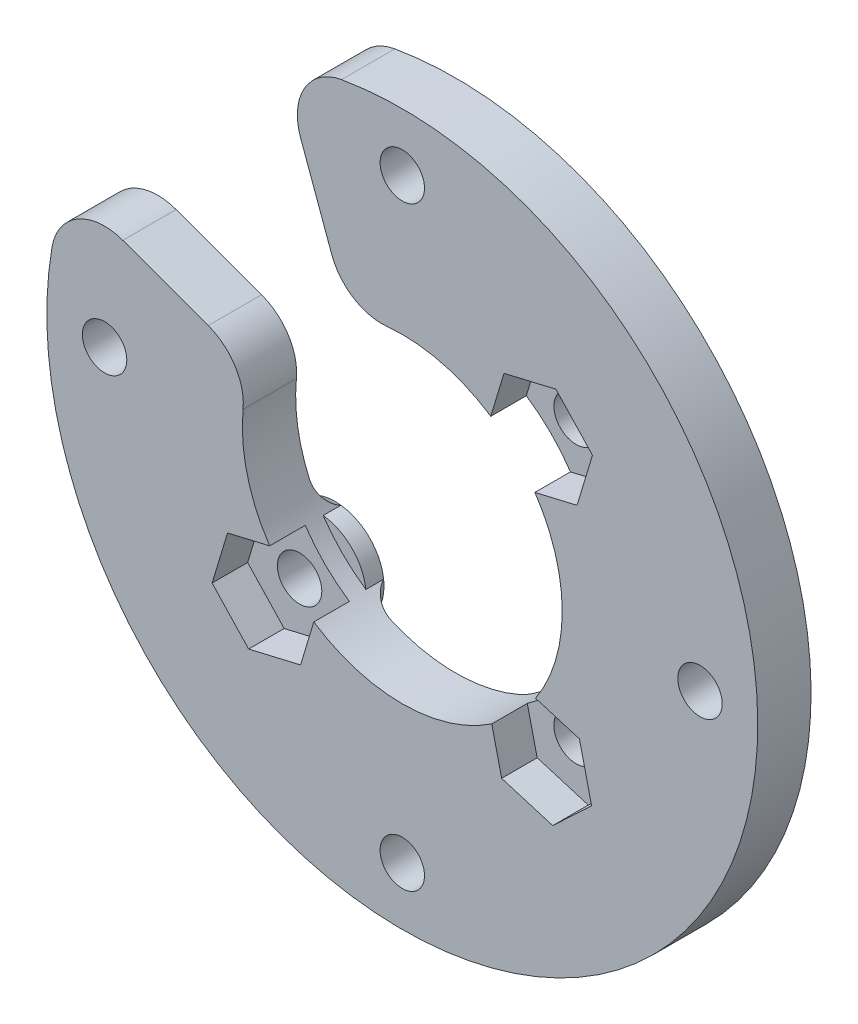
from build123d import *
from build123d.topology import SkipClean

# Parameters (mm, degrees)
SKETCH_1_R               = 20
SKETCH_1_R_2             = 1.25
SKETCH_1_R_3             = 9
EXTRUDE_5_DEPTH          = 3
SKETCH_1_6_R             = 9
SKETCH_1_6_R_2           = 2.3
SKETCH_1_6_R_3           = 1.25
CUT_EXTRUDE_1_DEPTH      = 1.1
SKETCH_2_R               = 1.25
CUT_EXTRUDE_2_DEPTH      = 31
EXTRUDE_START            = 1
SKETCH_3_R               = 2.75
SKETCH_3_R_2             = 1.25
EXTRUDE_6_DEPTH          = 1
FILLET_1_R               = 1.5
CUT_EXTRUDE_3_DEPTH      = 2
CUT_EXTRUDE_4_DEPTH      = 29.442925317
CUT_EXTRUDE_4_DEPTH_BACK = 29.442925317
FILLET_2_R               = 3


with BuildPart() as part:
    # 草图1 → 凸台-拉伸5 (new body)
    with BuildSketch(Plane.XY):
        Circle(SKETCH_1_R)
        with Locations((0, 16.75)):
            Circle(SKETCH_1_R_2, mode=Mode.SUBTRACT)
        with Locations((16.75, 0)):
            Circle(SKETCH_1_R_2, mode=Mode.SUBTRACT)
        with Locations((0, -16.75)):
            Circle(SKETCH_1_R_2, mode=Mode.SUBTRACT)
        with Locations((-16.75, 0)):
            Circle(SKETCH_1_R_2, mode=Mode.SUBTRACT)
        Circle(SKETCH_1_R_3, mode=Mode.SUBTRACT)
    extrude(amount=EXTRUDE_5_DEPTH)

    # 草图1<6> → 切除-拉伸1 (cut)
    # profile 1 of 8: a face of its own
    with BuildSketch(Plane.XY):
        Circle(SKETCH_1_6_R)
    # profile 2 of 8: a face of its own
    with BuildSketch(Plane.XY):
        with Locations((16.75, 0)):
            Circle(SKETCH_1_6_R_2)
        with Locations((16.75, 0)):
            Circle(SKETCH_1_6_R_3, mode=Mode.SUBTRACT)
    # profile 3 of 8: a face of its own
    with BuildSketch(Plane.XY):
        Circle(SKETCH_1_6_R)
    # profile 4 of 8: a face of its own
    with BuildSketch(Plane.XY):
        with Locations((0, 16.75)):
            Circle(SKETCH_1_6_R_2)
        with Locations((0, 16.75)):
            Circle(SKETCH_1_6_R_3, mode=Mode.SUBTRACT)
    # profile 5 of 8: a face of its own
    with BuildSketch(Plane.XY):
        Circle(SKETCH_1_6_R)
    # profile 6 of 8: a face of its own
    with BuildSketch(Plane.XY):
        with Locations((-16.75, 0)):
            Circle(SKETCH_1_6_R_2)
        with Locations((-16.75, 0)):
            Circle(SKETCH_1_6_R_3, mode=Mode.SUBTRACT)
    # profile 7 of 8: a face of its own
    with BuildSketch(Plane.XY):
        Circle(SKETCH_1_6_R)
    # profile 8 of 8: a face of its own
    with BuildSketch(Plane.XY):
        with Locations((0, -16.75)):
            Circle(SKETCH_1_6_R_2)
        with Locations((0, -16.75)):
            Circle(SKETCH_1_6_R_3, mode=Mode.SUBTRACT)
    extrude(amount=CUT_EXTRUDE_1_DEPTH, mode=Mode.SUBTRACT)

    # 草图2 → 切除-拉伸2 (cut)
    with BuildSketch(Plane.XY):
        with Locations((-7.778174593, 7.778174593)):
            Circle(SKETCH_2_R)
        with Locations((7.778174593, 7.778174593)):
            Circle(SKETCH_2_R)
        with Locations((7.778174593, -7.778174593)):
            Circle(SKETCH_2_R)
        with Locations((-7.778174593, -7.778174593)):
            Circle(SKETCH_2_R)
    extrude(amount=CUT_EXTRUDE_2_DEPTH, mode=Mode.SUBTRACT)

    # 草图3 → 凸台-拉伸6 (add)
    # profile 1 of 4: a face of its own
    with SkipClean():  # the faces are left unmerged after this step: merging them gives an invalid solid
        with BuildSketch(Plane(origin=(0, 0, 0), x_dir=(-1, 0, 0), z_dir=(0, 0, -1)).offset(EXTRUDE_START)):
            with Locations(Location((7.778174593, 7.778174593, 0), (0, 0, 186.827815893))):
                Circle(SKETCH_3_R)
            with Locations((7.778174593, 7.778174593)):
                Circle(SKETCH_3_R_2, mode=Mode.SUBTRACT)
        # profile 2 of 4: a face of its own
        with BuildSketch(Plane(origin=(0, 0, 0), x_dir=(-1, 0, 0), z_dir=(0, 0, -1)).offset(EXTRUDE_START)):
            with Locations(Location((7.778174593, -7.778174593, 0), (0, 0, 173.172184107))):
                Circle(SKETCH_3_R)
            with Locations((7.778174593, -7.778174593)):
                Circle(SKETCH_3_R_2, mode=Mode.SUBTRACT)
        # profile 3 of 4: a face of its own
        with BuildSketch(Plane(origin=(0, 0, 0), x_dir=(-1, 0, 0), z_dir=(0, 0, -1)).offset(EXTRUDE_START)):
            with Locations(Location((-7.778174593, -7.778174593, 0), (0, 0, 83.172184107))):
                Circle(SKETCH_3_R)
            with Locations((-7.778174593, -7.778174593)):
                Circle(SKETCH_3_R_2, mode=Mode.SUBTRACT)
        # profile 4 of 4: a face of its own
        with BuildSketch(Plane(origin=(0, 0, 0), x_dir=(-1, 0, 0), z_dir=(0, 0, -1)).offset(EXTRUDE_START)):
            with Locations(Location((-7.778174593, 7.778174593, 0), (0, 0, 276.827815893))):
                Circle(SKETCH_3_R)
            with Locations((-7.778174593, 7.778174593)):
                Circle(SKETCH_3_R_2, mode=Mode.SUBTRACT)
        extrude(amount=-EXTRUDE_6_DEPTH)

    # 圆角1
    # the kernel refuses this fillet: 1.5 mm, written as the material it adds along each edge
    with BuildSketch(Plane(origin=(-7.778174593, 7.778174593, 0), x_dir=(0.7048818539428432, -0.709324729571795, 0), z_dir=(0.709324729571795, 0.7048818539428432, 0))) as fillet_1_piece_1_section:
        with BuildLine():
            CenterArc((4.164213562, 1.5), FILLET_1_R, 199.471220634, 70.528779366)
            Line((2.75, 1), (2.75, 0))
            Line((2.75, 0), (4.164213562, 0))
        make_face()
    fillet_1_piece_1 = revolve(axis=Axis((-7.778174593, 7.778174593, 0), (0, 0, -1)), revolution_arc=359.64, mode=Mode.PRIVATE)
    fillet_1_piece_1 = fillet_1_piece_1 - Plane(origin=(0, 0, -0.272805639), x_dir=(1, 0, 0), z_dir=(0, 0, -1)) * Cylinder(9, 17, mode=Mode.PRIVATE)
    add(fillet_1_piece_1)
    with BuildSketch(Plane(origin=(-7.778174593, -7.778174593, 0), x_dir=(0.7093247295728082, 0.7048818539418237, 0), z_dir=(-0.7048818539418237, 0.7093247295728082, 0))) as fillet_1_piece_2_section:
        with BuildLine():
            CenterArc((4.164213562, 1.5), FILLET_1_R, 199.471220634, 70.528779366)
            Line((2.75, 1), (2.75, 0))
            Line((2.75, 0), (4.164213562, 0))
        make_face()
    fillet_1_piece_2 = revolve(axis=Axis((-7.778174593, -7.778174593, 0), (0, 0, -1)), revolution_arc=359.64, mode=Mode.PRIVATE)
    fillet_1_piece_2 = fillet_1_piece_2 - Plane(origin=(0, 0, -0.272805639), x_dir=(1, 0, 0), z_dir=(0, 0, -1)) * Cylinder(9, 17, mode=Mode.PRIVATE)
    add(fillet_1_piece_2)
    with BuildSketch(Plane(origin=(7.778174593, -7.778174593, 0), x_dir=(-0.7048818539418643, 0.7093247295727678, 0), z_dir=(-0.7093247295727678, -0.7048818539418643, 0))) as fillet_1_piece_3_section:
        with BuildLine():
            CenterArc((4.164213562, 1.5), FILLET_1_R, 199.471220634, 70.528779366)
            Line((2.75, 1), (2.75, 0))
            Line((2.75, 0), (4.164213562, 0))
        make_face()
    fillet_1_piece_3 = revolve(axis=Axis((7.778174593, -7.778174593, 0), (0, 0, -1)), revolution_arc=359.64, mode=Mode.PRIVATE)
    fillet_1_piece_3 = fillet_1_piece_3 - Plane(origin=(0, 0, -0.272805639), x_dir=(1, 0, 0), z_dir=(0, 0, -1)) * Cylinder(9, 17, mode=Mode.PRIVATE)
    add(fillet_1_piece_3)
    with BuildSketch(Plane(origin=(7.778174593, 7.778174593, 0), x_dir=(-0.7093247295718554, -0.7048818539427826, 0), z_dir=(0.7048818539427826, -0.7093247295718554, 0))) as fillet_1_piece_4_section:
        with BuildLine():
            CenterArc((4.164213562, 1.5), FILLET_1_R, 199.471220634, 70.528779366)
            Line((2.75, 1), (2.75, 0))
            Line((2.75, 0), (4.164213562, 0))
        make_face()
    fillet_1_piece_4 = revolve(axis=Axis((7.778174593, 7.778174593, 0), (0, 0, -1)), revolution_arc=359.64, mode=Mode.PRIVATE)
    fillet_1_piece_4 = fillet_1_piece_4 - Plane(origin=(0, 0, -0.272805639), x_dir=(1, 0, 0), z_dir=(0, 0, -1)) * Cylinder(9, 17, mode=Mode.PRIVATE)
    add(fillet_1_piece_4)

    # 草图4 → 切除-拉伸3 (cut)
    with BuildSketch(Plane.XY.offset(3)):
        Polygon((6.911384071, 4.903803788), (9.834057469, 5.590326579), (10.700847991, 8.464697384), (8.644965115, 10.652545398), (5.722291717, 9.966022607), (4.855501195, 7.091651802), align=None)
        Polygon((-8.464697384, 10.700847991), (-10.652545398, 8.644965115), (-9.966022607, 5.722291717), (-7.091651802, 4.855501195), (-4.903803788, 6.911384071), (-5.590326579, 9.834057469), align=None)
        Polygon((4.903803788, -6.911384071), (5.590326579, -9.834057469), (8.464697384, -10.700847991), (10.652545398, -8.644965115), (9.966022607, -5.722291717), (7.091651802, -4.855501195), align=None)
        Polygon((-6.911384071, -4.903803788), (-9.834057469, -5.590326579), (-10.700847991, -8.464697384), (-8.644965115, -10.652545398), (-5.722291717, -9.966022607), (-4.855501195, -7.091651802), align=None)
    extrude(amount=-CUT_EXTRUDE_3_DEPTH, mode=Mode.SUBTRACT)

    # 草图5 → 切除-拉伸4 (cut, two sides: drawn at the far end of the back side and taken through both)
    with BuildSketch(Plane(origin=(0, 0, 0), x_dir=(-1, 0, 0), z_dir=(0, 0, -1)).offset(-CUT_EXTRUDE_4_DEPTH_BACK)):
        with BuildLine():
            ThreePointArc((8.231627484, 3.638723534), (8.349136055, 3.360346282), (8.457233587, 3.07818129))
            Line((8.457233587, 3.07818129), (18.793852416, 6.840402867))
            ThreePointArc((18.793852416, 6.840402867), (16.867828916, 10.745992167), (14.142135624, 14.142135624))
            Line((14.142135624, 14.142135624), (10.722718241, 10.722718241))
            ThreePointArc((10.722718241, 10.722718241), (11.706576351, 6.396749887), (8.231627484, 3.638723534))
        make_face()
        with BuildLine():
            Line((6.840402867, 18.793852416), (3.07818129, 8.457233587))
            ThreePointArc((3.07818129, 8.457233587), (3.360346282, 8.349136055), (3.638723534, 8.231627484))
            ThreePointArc((3.638723534, 8.231627484), (6.396749887, 11.706576351), (10.722718241, 10.722718241))
            Line((10.722718241, 10.722718241), (14.142135624, 14.142135624))
            ThreePointArc((14.142135624, 14.142135624), (10.745992167, 16.867828916), (6.840402867, 18.793852416))
        make_face()
        with BuildLine():
            Line((3.07818129, 8.457233587), (0, 0))
            Line((0, 0), (10.722718241, 10.722718241))
            ThreePointArc((10.722718241, 10.722718241), (6.396749887, 11.706576351), (3.638723534, 8.231627484))
            ThreePointArc((3.638723534, 8.231627484), (3.360346282, 8.349136055), (3.07818129, 8.457233587))
        make_face()
        with BuildLine():
            Line((10.722718241, 10.722718241), (0, 0))
            Line((0, 0), (8.457233587, 3.07818129))
            ThreePointArc((8.457233587, 3.07818129), (8.349136055, 3.360346282), (8.231627484, 3.638723534))
            ThreePointArc((8.231627484, 3.638723534), (11.706576351, 6.396749887), (10.722718241, 10.722718241))
        make_face()
    extrude(amount=CUT_EXTRUDE_4_DEPTH + CUT_EXTRUDE_4_DEPTH_BACK, mode=Mode.SUBTRACT)

    # 圆角2
    fillet_2_edges = [part.edges().sort_by_distance(p)[0] for p in [
        (-6.840402867, 18.793852416, 1.5),
        (-18.793852416, 6.840402867, 1.5),
        (-3.07818129, 8.457233587, 1.5),
        (-8.457233587, 3.07818129, 1.5),
    ]]
    fillet(fillet_2_edges, radius=FILLET_2_R)


solid = part.part
